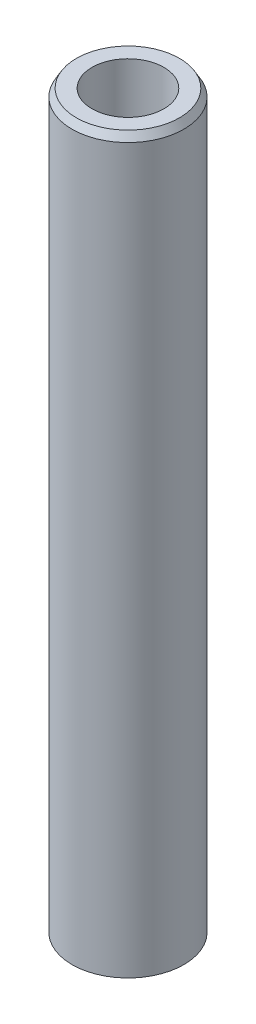
from build123d import *
from OCP.BRepFilletAPI import BRepFilletAPI_MakeChamfer

# Parameters (mm, degrees)
SKETCH1_R           = 37.5
BOSS_EXTRUDE1_DEPTH = 492.982544324
SKETCH2_R           = 24.096123597
CUT_EXTRUDE1_DEPTH  = 496.826874028
CHAMFER1_SIZE       = 5.123624477
CHAMFER1_SIZE2      = 2.958125971


with BuildPart() as part:
    # Sketch1 → Boss-Extrude1 (new body)
    with BuildSketch(Plane(origin=(0, 0, 0), x_dir=(1, 0, 0), z_dir=(0, 1, 0))):
        Circle(SKETCH1_R)
    extrude(amount=BOSS_EXTRUDE1_DEPTH)

    # Sketch2 → Cut-Extrude1 (cut, through all)
    with BuildSketch(Plane(origin=(0, 0, 0), x_dir=(1, 0, 0), z_dir=(0, 1, 0))):
        Circle(SKETCH2_R)
    extrude(amount=CUT_EXTRUDE1_DEPTH, mode=Mode.SUBTRACT)

    # Chamfer1: one chamfer whose edges measure the first distance from different faces: ONE call of the kernel's chamfer builder (chamfer() names one face for all edges)
    chamfer1_edges_1 = [part.edges().sort_by_distance(p)[0] for p in [
        (-37.5, 492.982544324, 0),
    ]]
    chamfer1_side_1 = [part.faces().sort_by_distance(p)[0] for p in [
        (-37.5, 246.491272162, 0),
    ]]
    chamfer1_edges_2 = [part.edges().sort_by_distance(p)[0] for p in [
        (-37.5, 0, 0),
    ]]
    chamfer1_side_2 = [part.faces().sort_by_distance(p)[0] for p in [
        (-36.439339828, 0, 0),
    ]]
    chamfer1 = BRepFilletAPI_MakeChamfer(part.part.solid().wrapped)
    for e in chamfer1_edges_1:
        chamfer1.Add(CHAMFER1_SIZE, CHAMFER1_SIZE2, e.wrapped, chamfer1_side_1[0].wrapped)  # the first distance lies on this face
    for e in chamfer1_edges_2:
        chamfer1.Add(CHAMFER1_SIZE, CHAMFER1_SIZE2, e.wrapped, chamfer1_side_2[0].wrapped)  # the first distance lies on this face
    add(Compound.cast(chamfer1.Shape()), mode=Mode.REPLACE)


solid = part.part
